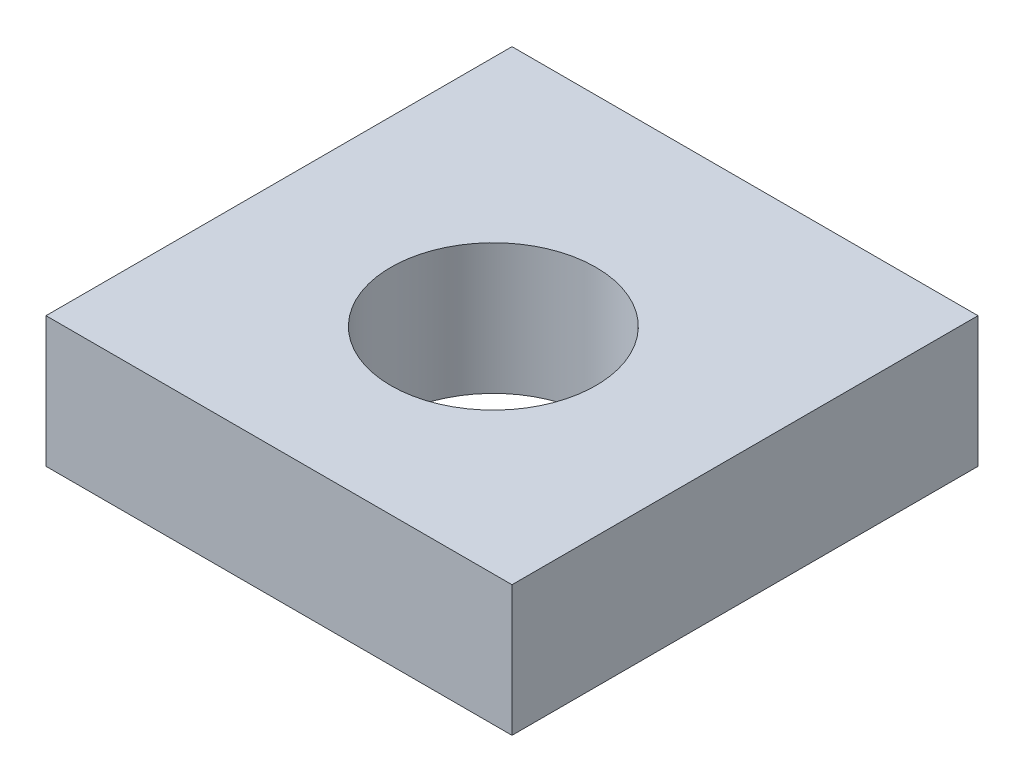
from build123d import *

# Parameters (mm, degrees)
SKETCH1_W           = 50
SKETCH1_H           = 50
BOSS_EXTRUDE1_DEPTH = 14
SKETCH2_R           = 11
CUT_EXTRUDE1_DEPTH  = 34


with BuildPart() as part:
    # Sketch1 → Boss-Extrude1 (new body)
    with BuildSketch(Plane(origin=(0, 478, 0), x_dir=(1, 0, 0), z_dir=(0, 1, 0))):
        with Locations((300, -155)):
            Rectangle(SKETCH1_W, SKETCH1_H)
    extrude(amount=BOSS_EXTRUDE1_DEPTH)

    # Sketch2 → Cut-Extrude1 (cut)
    with BuildSketch(Plane(origin=(0, 492, 0), x_dir=(1, 0, 0), z_dir=(0, 1, 0))):
        with Locations((300, -157)):
            Circle(SKETCH2_R)
    extrude(amount=-CUT_EXTRUDE1_DEPTH, mode=Mode.SUBTRACT)


solid = part.part
